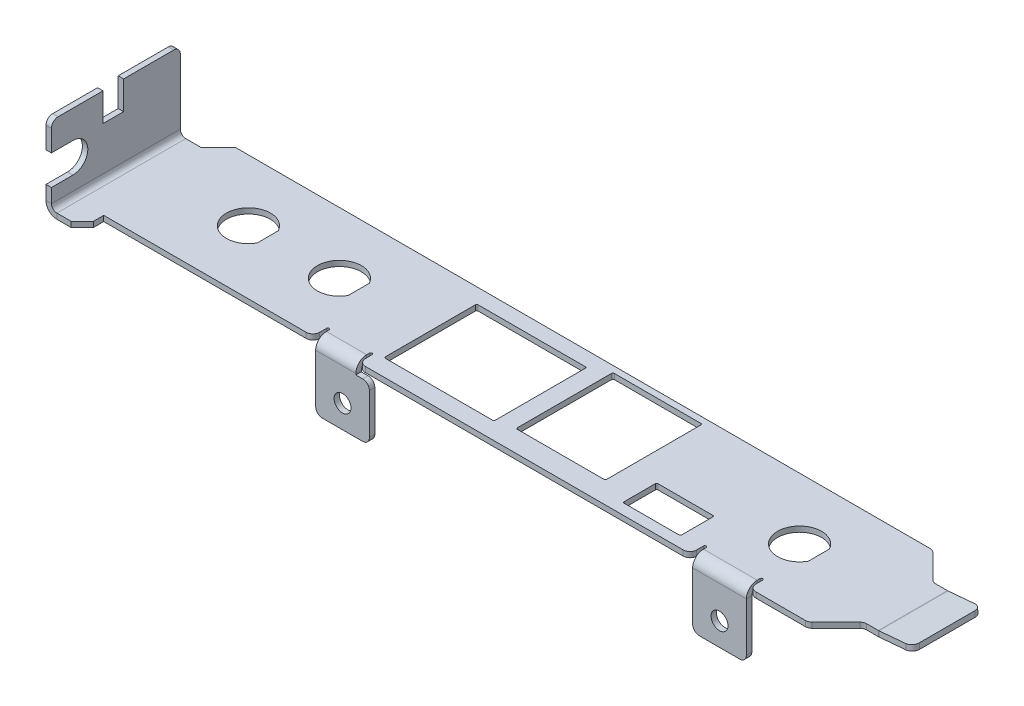
from build123d import *

# Parameters (mm, degrees)
SM_BASE_FLANGE_1_DEPTH           = 0.8
SKETCH_25_W                      = 16.240000001
SKETCH_25_H                      = 13.699999542
SKETCH_25_W_2                    = 13.2
SKETCH_25_H_2                    = 14.319999239
SKETCH_25_W_3                    = 8.5
SKETCH_25_H_3                    = 5
CUT_EXTRUDE_1_DEPTH              = 62.484573675
SM_EDGE_FLANGE_1_STRIP_CUT_DEPTH = 10.2
SM_EDGE_FLANGE_1_DEPTH           = 10.2
SM_START                         = -0.8
SM_EDGE_FLANGE_2_DEPTH           = 2.8
SM_START_2                       = 0.715504
SM_EDGE_FLANGE_2_2_OUTLINE_W     = 7.94
SM_EDGE_FLANGE_2_2_OUTLINE_H     = 0.8
SM_EDGE_FLANGE_2_2_DEPTH         = 1.284496
SM_START_3                       = -4.3519999
SM_EDGE_FLANGE_2_3_OUTLINE_W     = 7.94
SM_EDGE_FLANGE_2_3_OUTLINE_H     = 0.8
SM_EDGE_FLANGE_2_3_DEPTH         = 3.5519999
SM_START_4                       = -9
SM_EDGE_FLANGE_2_4_OUTLINE_W     = 7.94
SM_EDGE_FLANGE_2_4_OUTLINE_H     = 0.8
SM_EDGE_FLANGE_2_4_DEPTH         = 2.1479999
SM_START_5                       = 36.85
SM_EDGE_FLANGE_2_5_DEPTH         = 7.94
SM_EDGE_FLANGE_2_6_OUTLINE_W     = 2.5000002
SM_EDGE_FLANGE_2_6_OUTLINE_H     = 0.8
SM_EDGE_FLANGE_2_6_DEPTH         = 2.7199999
SM_START_6                       = 42.0700001
SM_EDGE_FLANGE_2_7_OUTLINE_W     = 2.5000002
SM_EDGE_FLANGE_2_7_OUTLINE_H     = 0.8
SM_EDGE_FLANGE_2_7_DEPTH         = 2.7199999
SM_START_7                       = 37.6657556
SM_EDGE_FLANGE_2_8_DEPTH         = 6.2856216
SM_START_8                       = 8.41
SM_EDGE_FLANGE_2_9_DEPTH         = 0.8
SM_START_9                       = -18.854
SM_EDGE_FLANGE_3_OUTLINE_W       = 8
SM_EDGE_FLANGE_3_OUTLINE_H       = 0.8
SM_EDGE_FLANGE_3_DEPTH           = 2.7199999
SM_START_10                      = -13.6339999
SM_EDGE_FLANGE_3_2_OUTLINE_W     = 8
SM_EDGE_FLANGE_3_2_OUTLINE_H     = 0.8
SM_EDGE_FLANGE_3_2_DEPTH         = 2.7199999
SM_START_11                      = -19.254
SM_EDGE_FLANGE_3_3_DEPTH         = 6.74
SM_EDGE_FLANGE_3_4_DEPTH         = 5.94
SM_EDGE_FLANGE_3_5_DEPTH         = 0.8
SM_START_12                      = -1
SM_EDGE_FLANGE_3_6_DEPTH         = 3
SM_EDGE_FLANGE_4_DEPTH           = 19.05
SM_START_13                      = 0.8
SM_EDGE_FLANGE_4_FLAT_DEPTH      = 0.8
FILLET_1_R                       = 1
FILLET_2_R                       = 0.2
CUT_EXTRUDE1_DEPTH               = 68.569638492


with BuildPart() as part:
    # Базовая кромка1: sheet metal written as solids
    # Sketch 1 → Базовая кромка1 (new body)
    with BuildSketch(Plane(origin=(0, 0, 0), x_dir=(1, 0, 0), z_dir=(0, 1, 0))):
        Polygon((53.93, 9.21), (58.04, 5.1), (60.22, 5.1), (60.22, -5.1), (58.04, -5.1), (53.93, -9.21), (-50.17, -9.21), (-50.17, -10.74), (-51.81, -12.38), (-53.93, -12.38), (-53.93, 6.67), (-51.59, 6.67), (-49.05, 9.21), align=None)
    extrude(amount=SM_BASE_FLANGE_1_DEPTH)

    # Эскиз25 → Вырез-Вытянуть1 (cut, through all)
    with BuildSketch(Plane(origin=(0, 0.8, 0), x_dir=(1, 0, 0), z_dir=(0, 1, 0))):
        with Locations((-3.145007461, 0.151324571)):
            Rectangle(SKETCH_25_W, SKETCH_25_H)
        with Locations((14.170071276, 1.126324154)):
            Rectangle(SKETCH_25_W_2, SKETCH_25_H_2)
        with Locations((29.1699949, -5.0986752)):
            Rectangle(SKETCH_25_W_3, SKETCH_25_H_3)
    extrude(amount=-CUT_EXTRUDE_1_DEPTH, mode=Mode.SUBTRACT)

    # Ребро-кромка1: sheet metal written as solids
    # Ребро-кромка1 strip (on a plane across the edge) → Ребро-кромка1 strip cut (cut)
    with BuildSketch(Plane(origin=(60.22, 0.8, 5.1), x_dir=(-0.08715574274765156, 0.9961946980917461, 0), z_dir=(0, 0, -1))):
        Polygon((-1.212259082, 4.677214117), (-0.793911517, -0.104520434), (0.003044242, -0.03479584), (-0.415303324, 4.746938711), align=None)
    extrude(amount=SM_EDGE_FLANGE_1_STRIP_CUT_DEPTH, mode=Mode.SUBTRACT)

    # Ребро-кромка1 section (on a plane across the edge) → Ребро-кромка1 (add)
    with BuildSketch(Plane(origin=(60.22, 0.8, 5.1), x_dir=(-0.08715574274765156, 0.9961946980917461, 0), z_dir=(0, 0, -1))):
        with BuildLine():
            Line((-0.8, 0.034928754), (-0.8, 5.019641982))
            Line((-0.8, 5.019641982), (0, 5.019641982))
            Line((0, 5.019641982), (0, 0.034928754))
            ThreePointArc((0, 0.034928754), (0.000761423, 3.3244e-05), (0.003044242, -0.03479584))
            Line((0.003044242, -0.03479584), (-0.793911517, -0.104520434))
            ThreePointArc((-0.793911517, -0.104520434), (-0.798477155, -0.034862265), (-0.8, 0.034928754))
        make_face()
    extrude(amount=SM_EDGE_FLANGE_1_DEPTH)

    # Ребро-кромка2: read off the stored shape, not the designer's step
    # Ребро-кромка2 outline → Ребро-кромка2 (cut)
    with BuildSketch(Plane(origin=(0, 0, 0), x_dir=(1, 0, 0), z_dir=(0, 1, 0)).offset(SM_START)):
        with BuildLine():
            Line((44.79, -7.21), (44.79, -9.21))
            Line((44.79, -9.21), (45.19, -9.21))
            Line((45.19, -9.21), (45.19, -7.21))
            ThreePointArc((45.19, -7.21), (44.99, -7.01), (44.79, -7.21))
        make_face()
        with BuildLine():
            Line((36.45, -9.21), (36.85, -9.21))
            Line((36.85, -9.21), (36.85, -7.21))
            ThreePointArc((36.85, -7.21), (36.65, -7.01), (36.45, -7.21))
            Line((36.45, -7.21), (36.45, -9.21))
        make_face()
    extrude(amount=SM_EDGE_FLANGE_2_DEPTH, mode=Mode.SUBTRACT)

    # Sm Edge Flange 2 2 outline → Sm Edge Flange 2 2 (cut)
    with BuildSketch(Plane(origin=(0, 0, 0), x_dir=(1, 0, 0), z_dir=(0, 1, 0)).offset(SM_START_2)):
        with Locations((40.82, -8.81)):
            Rectangle(SM_EDGE_FLANGE_2_2_OUTLINE_W, SM_EDGE_FLANGE_2_2_OUTLINE_H)
    extrude(amount=SM_EDGE_FLANGE_2_2_DEPTH, mode=Mode.SUBTRACT)

    # Sm Edge Flange 2 5 outline → Sm Edge Flange 2 5 (cut)
    with BuildSketch(Plane.YZ.offset(SM_START_5)):
        with BuildLine():
            Line((0, 9.21), (0, 8.995640646))
            ThreePointArc((0, 8.995640646), (0.585640646, 8.41), (0.8, 7.61))
            Line((0.8, 7.61), (0.8, 8.41))
            Line((0.8, 8.41), (0.715504, 8.41))
            Line((0.715504, 8.41), (0.715504, 9.21))
            Line((0.715504, 9.21), (0, 9.21))
        make_face()
    extrude(amount=SM_EDGE_FLANGE_2_5_DEPTH, mode=Mode.SUBTRACT)



with BuildPart() as body_2:
    # Sm Edge Flange 2 3 outline → Sm Edge Flange 2 3 (new body)
    with BuildSketch(Plane(origin=(0, 0, 0), x_dir=(1, 0, 0), z_dir=(0, 1, 0)).offset(SM_START_3)):
        with Locations((40.82, -8.81)):
            Rectangle(SM_EDGE_FLANGE_2_3_OUTLINE_W, SM_EDGE_FLANGE_2_3_OUTLINE_H)
    extrude(amount=SM_EDGE_FLANGE_2_3_DEPTH)


with BuildPart() as body_3:
    # Sm Edge Flange 2 4 outline → Sm Edge Flange 2 4 (new body)
    with BuildSketch(Plane(origin=(0, 0, 0), x_dir=(1, 0, 0), z_dir=(0, 1, 0)).offset(SM_START_4)):
        with Locations((40.82, -8.81)):
            Rectangle(SM_EDGE_FLANGE_2_4_OUTLINE_W, SM_EDGE_FLANGE_2_4_OUTLINE_H)
    extrude(amount=SM_EDGE_FLANGE_2_4_DEPTH)


with BuildPart() as part_1:
    add(part.part)

    add(body_2.part)  # Sm Edge Flange 2 6 merges body 2

    add(body_3.part)  # Sm Edge Flange 2 6 merges body 3
    # Sm Edge Flange 2 6 outline → Sm Edge Flange 2 6 (add)
    with BuildSketch(Plane.YZ.offset(SM_START_5)):
        with Locations((-5.602, 8.81)):
            Rectangle(SM_EDGE_FLANGE_2_6_OUTLINE_W, SM_EDGE_FLANGE_2_6_OUTLINE_H)
        with BuildLine():
            ThreePointArc((0, 8.995640646), (-0.385889528, 9.155481322), (-0.8, 9.21))
            Line((-0.8, 9.21), (-0.8, 8.41))
            ThreePointArc((-0.8, 8.41), (-0.234314575, 8.175685425), (0, 7.61))
            Line((0, 7.61), (0, 8.995640646))
        make_face()
    extrude(amount=SM_EDGE_FLANGE_2_6_DEPTH)

    # Sm Edge Flange 2 7 outline → Sm Edge Flange 2 7 (add)
    with BuildSketch(Plane.YZ.offset(SM_START_6)):
        with Locations((-5.602, 8.81)):
            Rectangle(SM_EDGE_FLANGE_2_7_OUTLINE_W, SM_EDGE_FLANGE_2_7_OUTLINE_H)
        with BuildLine():
            ThreePointArc((0, 8.995640646), (-0.385889528, 9.155481322), (-0.8, 9.21))
            Line((-0.8, 9.21), (-0.8, 8.41))
            ThreePointArc((-0.8, 8.41), (-0.234314575, 8.175685425), (0, 7.61))
            Line((0, 7.61), (0, 8.995640646))
        make_face()
    extrude(amount=SM_EDGE_FLANGE_2_7_DEPTH)

    # Sm Edge Flange 2 8 outline → Sm Edge Flange 2 8 (add)
    with BuildSketch(Plane.YZ.offset(SM_START_7)):
        with BuildLine():
            ThreePointArc((0, 8.995640646), (-0.385889528, 9.155481322), (-0.8, 9.21))
            Line((-0.8, 9.21), (-0.8, 8.41))
            ThreePointArc((-0.8, 8.41), (-0.234314575, 8.175685425), (0, 7.61))
            Line((0, 7.61), (0, 8.995640646))
        make_face()
    extrude(amount=SM_EDGE_FLANGE_2_8_DEPTH)

    # Sm Edge Flange 2 9 outline → Sm Edge Flange 2 9 (add)
    with BuildSketch(Plane.XY.offset(SM_START_8)):
        with BuildLine():
            Line((42.0700001, -6.8520001), (42.07, -5.602))
            ThreePointArc((42.07, -5.602), (41.703883476, -6.485883476), (40.82, -6.852))
            Line((40.82, -6.852), (42.0700001, -6.8520001))
        make_face()
        with BuildLine():
            ThreePointArc((40.82, -4.352), (41.703883476, -4.718116524), (42.07, -5.602))
            Line((42.07, -5.602), (42.0700001, -4.3519999))
            Line((42.0700001, -4.3519999), (40.82, -4.352))
        make_face()
        with BuildLine():
            ThreePointArc((39.57, -5.602), (39.936116524, -4.718116524), (40.82, -4.352))
            Line((40.82, -4.352), (39.5699999, -4.3519999))
            Line((39.5699999, -4.3519999), (39.57, -5.602))
        make_face()
        with BuildLine():
            Line((39.5699999, -6.8520001), (40.82, -6.852))
            ThreePointArc((40.82, -6.852), (39.936116524, -6.485883476), (39.57, -5.602))
            Line((39.57, -5.602), (39.5699999, -6.8520001))
        make_face()
    extrude(amount=SM_EDGE_FLANGE_2_9_DEPTH)

    # Sm Edge Flange 3 3 outline → Sm Edge Flange 3 3 (cut)
    with BuildSketch(Plane.YZ.offset(SM_START_11)):
        with BuildLine():
            Line((0, 9.21), (0, 8.995640646))
            ThreePointArc((0, 8.995640646), (0.585640646, 8.41), (0.8, 7.61))
            Line((0.8, 7.61), (0.8, 9.21))
            Line((0.8, 9.21), (0, 9.21))
        make_face()
    extrude(amount=SM_EDGE_FLANGE_3_3_DEPTH, mode=Mode.SUBTRACT)



with BuildPart() as body_2_2:
    # Ребро-кромка3: read off the stored shape, not the designer's step
    # Ребро-кромка3 outline → Ребро-кромка3 (new body)
    with BuildSketch(Plane.YZ.offset(SM_START_9)):
        with Locations((-5, 8.81)):
            Rectangle(SM_EDGE_FLANGE_3_OUTLINE_W, SM_EDGE_FLANGE_3_OUTLINE_H)
    extrude(amount=SM_EDGE_FLANGE_3_DEPTH)


with BuildPart() as body_3_2:
    # Sm Edge Flange 3 2 outline → Sm Edge Flange 3 2 (new body)
    with BuildSketch(Plane.YZ.offset(SM_START_10)):
        with Locations((-5, 8.81)):
            Rectangle(SM_EDGE_FLANGE_3_2_OUTLINE_W, SM_EDGE_FLANGE_3_2_OUTLINE_H)
    extrude(amount=SM_EDGE_FLANGE_3_2_DEPTH)


with BuildPart() as part_2:
    add(part_1.part)

    add(body_2_2.part)  # Sm Edge Flange 3 4 merges body 2 2

    add(body_3_2.part)  # Sm Edge Flange 3 4 merges body 3 2
    # Sm Edge Flange 3 4 outline → Sm Edge Flange 3 4 (add)
    with BuildSketch(Plane.YZ.offset(SM_START_9)):
        with BuildLine():
            Line((-0.8, 9.21), (-1, 9.21))
            Line((-1, 9.21), (-1, 8.41))
            Line((-1, 8.41), (-0.8, 8.41))
            ThreePointArc((-0.8, 8.41), (-0.234314575, 8.175685425), (0, 7.61))
            Line((0, 7.61), (0, 8.995640646))
            ThreePointArc((0, 8.995640646), (-0.385889528, 9.155481322), (-0.8, 9.21))
        make_face()
    extrude(amount=SM_EDGE_FLANGE_3_4_DEPTH)

    # Sm Edge Flange 3 5 outline → Sm Edge Flange 3 5 (add)
    with BuildSketch(Plane.XY.offset(SM_START_8)):
        with BuildLine():
            Line((-13.6339999, -9), (-13.634, -5.602))
            ThreePointArc((-13.634, -5.602), (-14.884, -6.852), (-16.134, -5.602))
            Line((-16.134, -5.602), (-16.1340001, -9))
            Line((-16.1340001, -9), (-13.6339999, -9))
        make_face()
        with BuildLine():
            ThreePointArc((-16.134, -5.602), (-14.884, -4.352), (-13.634, -5.602))
            Line((-13.634, -5.602), (-13.6339999, -1))
            Line((-13.6339999, -1), (-16.1340001, -1))
            Line((-16.1340001, -1), (-16.134, -5.602))
        make_face()
    extrude(amount=SM_EDGE_FLANGE_3_5_DEPTH)

    # Sm Edge Flange 3 6 outline → Sm Edge Flange 3 6 (cut)
    with BuildSketch(Plane(origin=(0, 0, 0), x_dir=(1, 0, 0), z_dir=(0, 1, 0)).offset(SM_START_12)):
        with BuildLine():
            Line((-18.854, -9), (-18.854, -7.21))
            ThreePointArc((-18.854, -7.21), (-19.054, -7.01), (-19.254, -7.21))
            Line((-19.254, -7.21), (-19.254, -9))
            Line((-19.254, -9), (-18.854, -9))
        make_face()
        with BuildLine():
            Line((-12.914, -7.21), (-12.914, -9))
            Line((-12.914, -9), (-12.514, -9))
            Line((-12.514, -9), (-12.514, -7.21))
            ThreePointArc((-12.514, -7.21), (-12.714, -7.01), (-12.914, -7.21))
        make_face()
    extrude(amount=SM_EDGE_FLANGE_3_6_DEPTH, mode=Mode.SUBTRACT)

    # Ребро-кромка4: sheet metal written as solids
    # Ребро-кромка4 bend section (on a plane across the edge) → Ребро-кромка4 (add)
    with BuildSketch(Plane(origin=(-54.73, 0.8, -6.67), x_dir=(1, 0, 0), z_dir=(0, 0, 1))):
        with BuildLine():
            Line((-0.8, 0.8), (0, 0.8))
            ThreePointArc((0, 0.8), (0.234314575, 0.234314575), (0.8, 0))
            Line((0.8, 0), (0.8, -0.8))
            ThreePointArc((0.8, -0.8), (-0.33137085, -0.33137085), (-0.8, 0.8))
        make_face()
    extrude(amount=SM_EDGE_FLANGE_4_DEPTH)

    # Ребро-кромка4 profile (on flange) → Ребро-кромка4 flat (add)
    with BuildSketch(Plane(origin=(-54.73, 0.8, 0), x_dir=(0, 0, 1), z_dir=(-1, 0, 0)).offset(SM_START_13)):
        with BuildLine():
            Line((-6.67, 11.43), (-6.67, 0.8))
            Line((-6.67, 0.8), (12.38, 0.8))
            Line((12.38, 0.8), (12.38, 2.87))
            Line((12.38, 2.87), (9.21, 2.87))
            ThreePointArc((9.21, 2.87), (7, 5.08), (9.21, 7.29))
            Line((9.21, 7.29), (12.38, 7.29))
            Line((12.38, 7.29), (12.38, 11.43))
            Line((12.38, 11.43), (4.76, 11.43))
            Line((4.76, 11.43), (4.76, 7.24))
            Line((4.76, 7.24), (1.71, 7.24))
            Line((1.71, 7.24), (1.71, 11.43))
            Line((1.71, 11.43), (-6.67, 11.43))
        make_face()
    extrude(amount=-SM_EDGE_FLANGE_4_FLAT_DEPTH)

    # Скругление1
    fillet_1_edges = [part_2.edges().sort_by_distance(p)[0] for p in [
        (65.255403026, 0.839012746, 5.1),
        (65.255403026, 0.839012746, -5.1),
        (36.45, 0.4, 9.21),
        (45.19, 0.4, 9.21),
        (44.79, -9, 8.81),
        (36.85, -9, 8.81),
        (-19.254, 0.4, 9.21),
        (-12.514, 0.4, 9.21),
        (-18.854, -9, 8.81),
        (-10.914, -9, 8.81),
        (-10.914, -1, 8.81),
        (53.93, 0.4, -9.21),
        (58.04, 0.4, -5.1),
        (58.04, 0.4, 5.1),
        (53.93, 0.4, 9.21),
        (-55.13, 12.23, -6.67),
        (-55.13, 12.23, 12.38),
    ]]
    fillet(fillet_1_edges, radius=FILLET_1_R)

    # Скругление2
    fillet_2_edges = [part_2.edges().sort_by_distance(p)[0] for p in [
        (-11.265007461, 0.4, 6.6986752),
        (-11.265007461, 0.4, -7.001324342),
        (4.97499254, 0.4, -7.001324342),
        (4.97499254, 0.4, 6.6986752),
        (7.570071276, 0.4, 6.033675466),
        (7.570071276, 0.4, -8.286323773),
        (20.770071276, 0.4, -8.286323773),
        (20.770071276, 0.4, 6.033675466),
        (33.4199949, 0.4, 2.5986752),
        (33.4199949, 0.4, 7.5986752),
        (24.9199949, 0.4, 7.5986752),
        (24.9199949, 0.4, 2.5986752),
    ]]
    fillet(fillet_2_edges, radius=FILLET_2_R)

    # Sketch2 → Cut-Extrude1 (cut, through all)
    with BuildSketch(Plane.XZ):
        with BuildLine():
            Line((-21.856671641, 1.410725364), (-21.856671641, -1.713374506))
            ThreePointArc((-21.856671641, -1.713374506), (-27.956671641, -0.151324571), (-21.856671641, 1.410725364))
        make_face()
        with BuildLine():
            Line((-35.29833582, 1.410725364), (-35.29833582, -1.713374506))
            ThreePointArc((-35.29833582, -1.713374506), (-41.39833582, -0.151324571), (-35.29833582, 1.410725364))
        make_face()
        with BuildLine():
            Line((46.1399949, 1.410725364), (46.1399949, -1.713374506))
            ThreePointArc((46.1399949, -1.713374506), (40.0399949, -0.151324571), (46.1399949, 1.410725364))
        make_face()
    extrude(amount=-CUT_EXTRUDE1_DEPTH, mode=Mode.SUBTRACT)


solid = part_2.part
